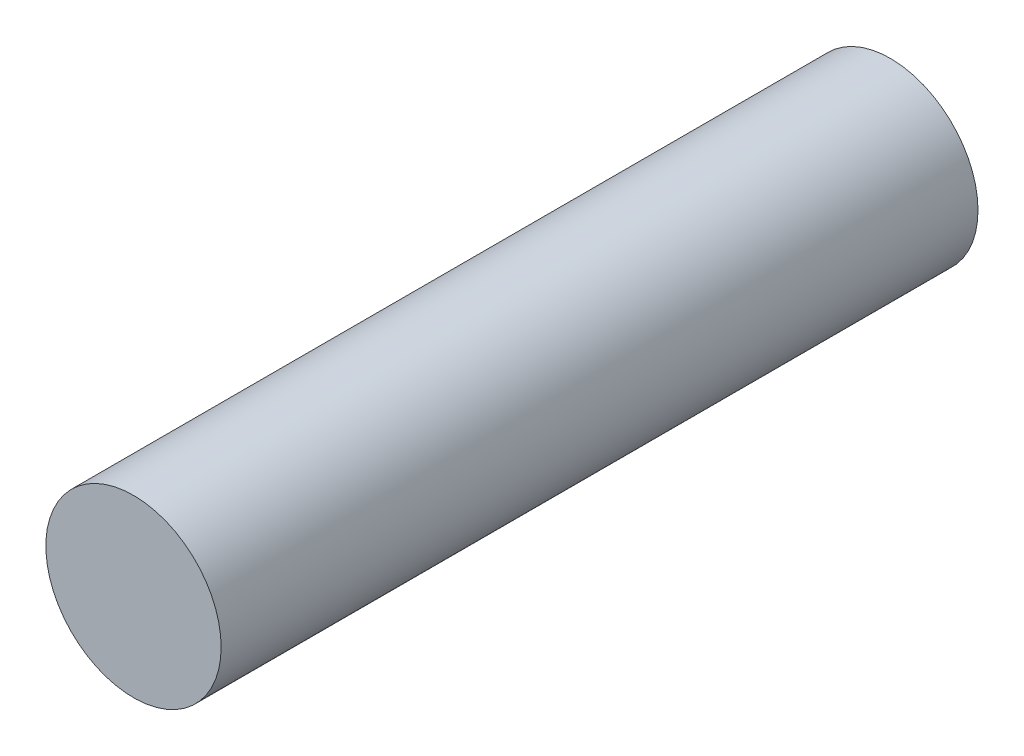
from build123d import *

# Parameters (mm, degrees)
BOSS_EXTRUDE1_DEPTH      = 8
BOSS_EXTRUDE1_DEPTH_BACK = 13.5
SKETCH1_R                = 2.49


with BuildPart() as part:
    # Sketch1 → Boss-Extrude1 (new, two sides: drawn at the far end of the back side and taken through both)
    with BuildSketch(Plane.XY.offset(-BOSS_EXTRUDE1_DEPTH_BACK)):
        Circle(SKETCH1_R)
    extrude(amount=BOSS_EXTRUDE1_DEPTH + BOSS_EXTRUDE1_DEPTH_BACK)


solid = part.part
